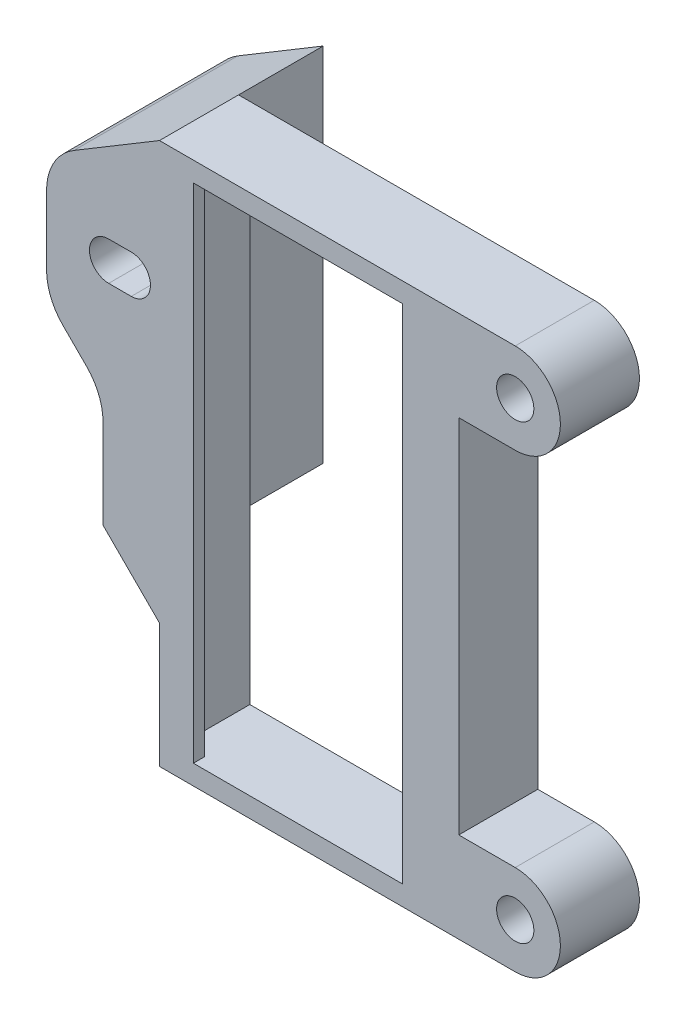
from build123d import *

# Parameters (mm, degrees)
ESBO_O1_W                = 24.5
ESBO_O1_H                = 48
ESBO_O1_W_2              = 18.5
ESBO_O1_H_2              = 44.5
RESSALTO_EXTRUS_O1_DEPTH = 1
ESBO_O2_R                = 1.65
ESBO_O2_W                = 22.5
ESBO_O2_H                = 44.5
RESSALTO_EXTRUS_O2_DEPTH = 7
RESSALTO_EXTRUS_O3_DEPTH = 14.5
FILETE1_R                = 5
CHANFRO4_SIZE            = 5


with BuildPart() as part:
    # Esboço1 → Ressalto-extrusão1 (new body)
    with BuildSketch(Plane.XY):
        Rectangle(ESBO_O1_W, ESBO_O1_H)
        Rectangle(ESBO_O1_W_2, ESBO_O1_H_2, mode=Mode.SUBTRACT)
    extrude(amount=RESSALTO_EXTRUS_O1_DEPTH)

    # Esboço2 → Ressalto-extrusão2 (add)
    with BuildSketch(Plane.XY.offset(1)):
        with BuildLine():
            Line((19.25, 16), (14.25, 16))
            Line((14.25, 16), (14.25, -16))
            Line((14.25, -16), (19.25, -16))
            ThreePointArc((19.25, -16), (23.25, -20), (19.25, -24))
            Line((19.25, -24), (12.25, -24))
            Line((12.25, -24), (-12.25, -24))
            Line((-12.25, -24), (-12.25, 24))
            Line((-12.25, 24), (12.25, 24))
            Line((12.25, 24), (19.25, 24))
            ThreePointArc((19.25, 24), (23.25, 20), (19.25, 16))
        make_face()
        with Locations((19.25, 20)):
            Circle(ESBO_O2_R, mode=Mode.SUBTRACT)
        with Locations((19.25, -20)):
            Circle(ESBO_O2_R, mode=Mode.SUBTRACT)
        Rectangle(ESBO_O2_W, ESBO_O2_H, mode=Mode.SUBTRACT)
    extrude(amount=-RESSALTO_EXTRUS_O2_DEPTH)

    # Esboço4 → Ressalto-extrusão3 (add)
    with BuildSketch(Plane.XY.offset(1)):
        Polygon((-12.25, -8), (-12.25, 24), (-22.25, 18), (-22.25, 7), (-17.25, 2), (-17.25, -8), align=None)
        with BuildLine():
            ThreePointArc((-16.75, 10.8), (-18.45, 12.5), (-16.75, 14.2))
            Line((-16.75, 14.2), (-14.75, 14.2))
            ThreePointArc((-14.75, 14.2), (-13.05, 12.5), (-14.75, 10.8))
            Line((-14.75, 10.8), (-16.75, 10.8))
        make_face(mode=Mode.SUBTRACT)
    extrude(amount=-RESSALTO_EXTRUS_O3_DEPTH)

    # Filete1
    filete1_edges = [part.edges().sort_by_distance(p)[0] for p in [
        (-17.25, 2, -6.25),
        (-22.25, 7, -6.25),
        (-22.25, 18, -6.25),
    ]]
    fillet(filete1_edges, radius=FILETE1_R)

    # Chanfro4
    chanfro4_edges = [part.edges().sort_by_distance(p)[0] for p in [
        (-12.25, -8, -2.5),
    ]]
    chamfer(chanfro4_edges, length=CHANFRO4_SIZE - 0.0001)  # a hair under: the kernel refuses the full size


solid = part.part
